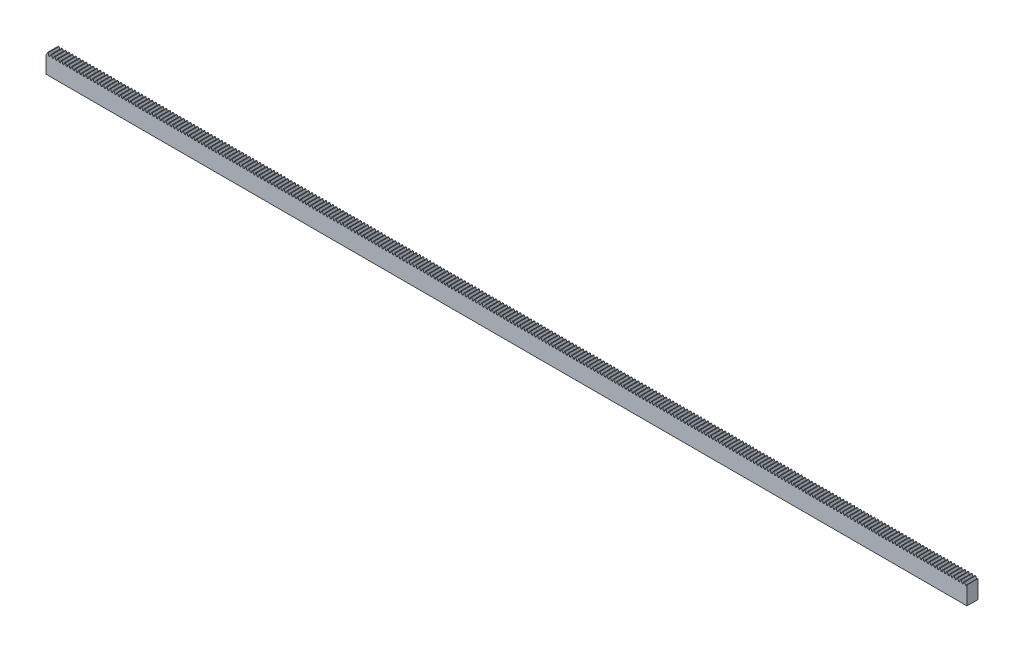
from build123d import *

# Parameters (mm, degrees)
BLANKSKE_W        = 500
BLANKSKE_H        = 10.6
BLANK_DEPTH       = 6
TOOTHCUTSIM_DEPTH = 501.148337996
TEETHCUTS_COUNT   = 266
TEETHCUTS_PITCH   = 1.88495559


with BuildPart() as part:
    # BlankSke → Blank (new body)
    with BuildSketch(Plane.XY):
        with Locations((250, 5.3)):
            Rectangle(BLANKSKE_W, BLANKSKE_H)
    extrude(amount=-BLANK_DEPTH)

    # TooCutSkeSim → ToothCutSim (cut, through all)
    with BuildSketch(Plane.XY):
        Polygon((0.267261222, 9.25), (-0.267261222, 9.25), (-0.767865882, 10.6254), (0.767865882, 10.6254), align=None)
    toothcutsim = extrude(amount=-TOOTHCUTSIM_DEPTH, mode=Mode.SUBTRACT)

    # TeethCuts: ToothCutSim ×266
    with Locations(*[(i * TEETHCUTS_PITCH, 0, 0) for i in range(1, TEETHCUTS_COUNT)]):
        add(toothcutsim, mode=Mode.SUBTRACT)


solid = part.part
